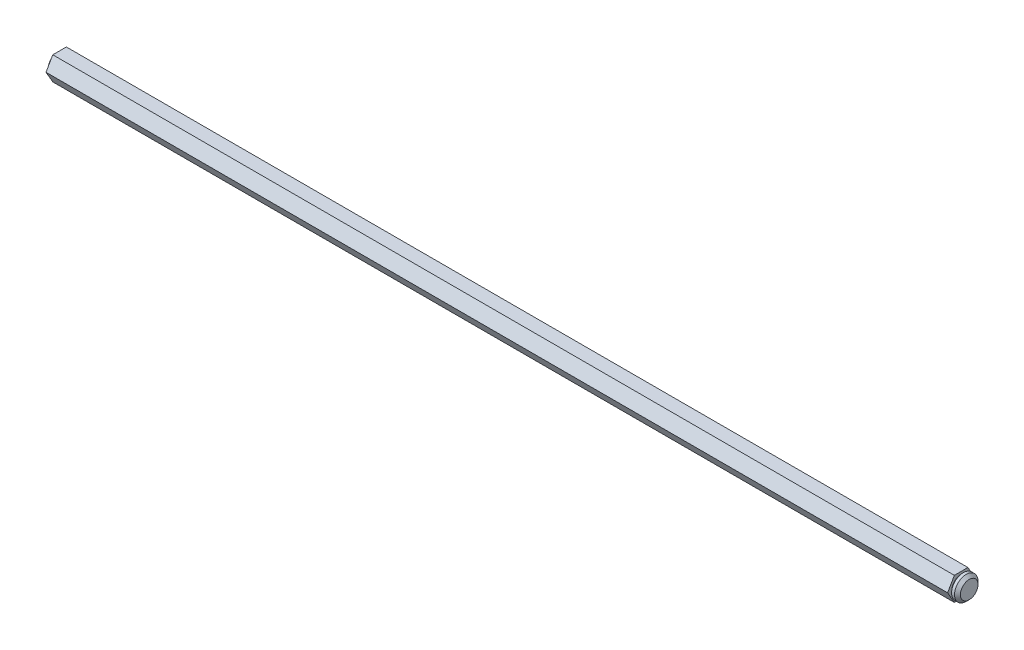
from build123d import *

# Parameters (mm, degrees)
BOSS_EXTRUDE1_DEPTH = 243.68125
SKETCH2_R           = 5.0292
BOSS_EXTRUDE2_DEPTH = 1.1684
SKETCH3_R           = 6.35
BOSS_EXTRUDE3_DEPTH = 3.175
CHAMFER1_SIZE       = 1.5875
MIRROR2_START       = -244.84965
MIRROR2_OUTLINE_R   = 5.0292
MIRROR2_DEPTH       = 1.1684


# Read off the part's stored shape, not the designer's step: Mirror2
with BuildPart() as part:
    # Sketch1 → Boss-Extrude1 (new, symmetric)
    with BuildSketch(Plane(origin=(0, 0, 0), x_dir=(0, 0, -1), z_dir=(1, 0, 0))):
        Polygon((-3.666174209, 6.35), (-7.332348419, 0), (-3.666174209, -6.35), (3.666174209, -6.35), (7.332348419, 0), (3.666174209, 6.35), align=None)
    extrude(amount=BOSS_EXTRUDE1_DEPTH, both=True)

    # Sketch2 → Boss-Extrude2 (add)
    with BuildSketch(Plane(origin=(243.68125, 0, 0), x_dir=(0, 0, -1), z_dir=(1, 0, 0))):
        Circle(SKETCH2_R)
    extrude(amount=BOSS_EXTRUDE2_DEPTH)

    # Mirror2 outline → Mirror2 (add)
    with BuildSketch(Plane.YZ.offset(MIRROR2_START)):
        Circle(MIRROR2_OUTLINE_R)
    extrude(amount=MIRROR2_DEPTH)


with BuildPart() as body_2:
    # Sketch3 → Boss-Extrude3 (new body)
    with BuildSketch(Plane(origin=(244.84965, 0, 0), x_dir=(0, 0, -1), z_dir=(1, 0, 0))):
        Circle(SKETCH3_R)
    extrude(amount=BOSS_EXTRUDE3_DEPTH)

    # Chamfer1
    chamfer1_edges = [body_2.edges().sort_by_distance(p)[0] for p in [
        (248.02465, 0, 6.35),
    ]]
    chamfer(chamfer1_edges, length=CHAMFER1_SIZE)


solid = Compound([part.part, body_2.part])
